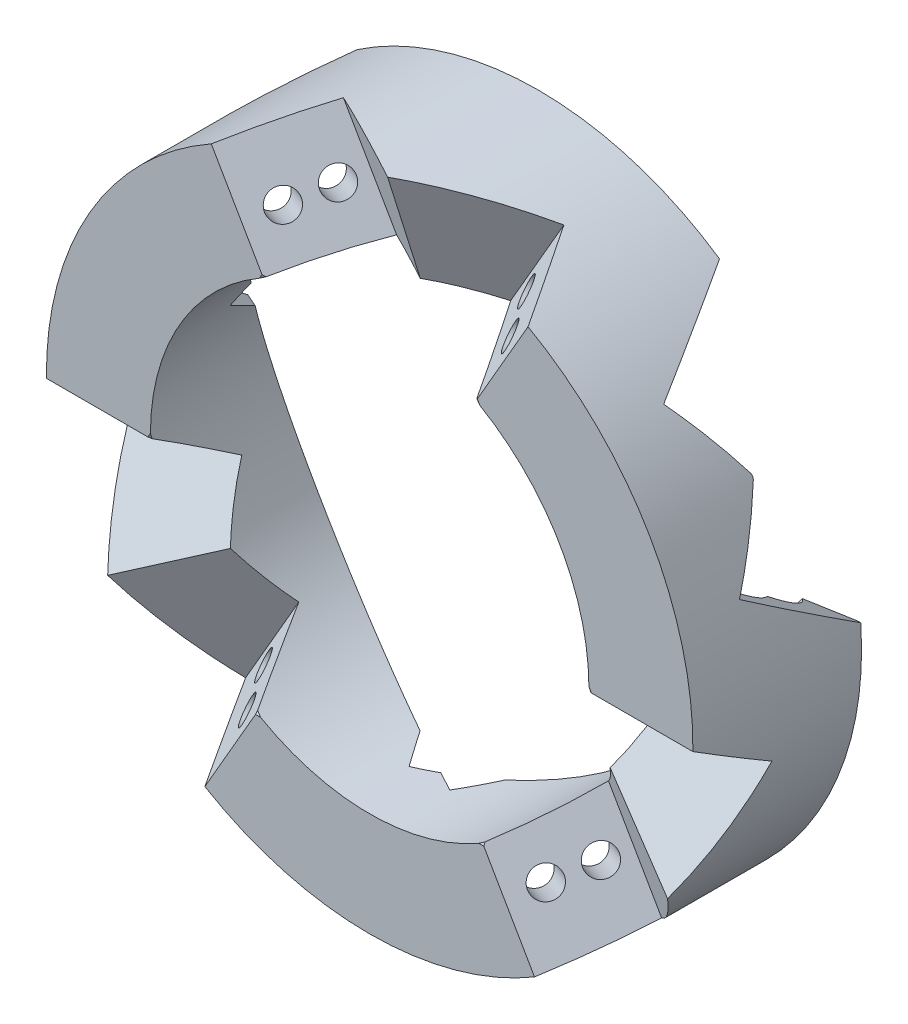
from build123d import *

# Parameters (mm, degrees)
ESQUISSE1_R                            = 57.5
ESQUISSE1_R_2                          = 39
BOSS_EXTRU_1_DEPTH                     = 30
EMPREINTE1_START                       = -29.216029699
EMPREINTE1_OUTLINE_W                   = 12.7
EMPREINTE1_OUTLINE_H                   = 43.583730479
EMPREINTE1_OUTLINE_R                   = 2
EMPREINTE1_DEPTH                       = 12.7
EMPREINTE1_2_OUTLINE_R                 = 2
EMPREINTE1_2_DEPTH                     = 12.7
EMPREINTE1_START_2                     = 16.516029699
EMPREINTE1_3_OUTLINE_R                 = 2
EMPREINTE1_3_DEPTH                     = 12.7
ENL_V_MAT_EXTRU_1_DEPTH                = 98.239996451
ENL_V_MAT_EXTRU_4_DEPTH                = 98.239996451
ENL_V_START                            = -56.415565666
ENL_V_MAT_EXTRU_7_DEPTH                = 36.415565666
R_P_TITION_CIRCULAIRE3_COUNT           = 3
R_P_TITION_CIRCULAIRE1_COUNT           = 3
R_P_TITION_START                       = -56.415565666
R_P_TITION_CIRCULAIRE1_COPY_1_DEPTH    = 36.415565666
R_P_TITION_CIRCULAIRE1_COPY_2_DEPTH    = 36.415565666
ESQUISSE9_R                            = 2.5
ENL_V_MAT_EXTRU_8_DEPTH                = 95.163964789
ENL_V_START_2                          = -10
ENL_V_MAT_EXTRU_9_DEPTH                = 85.163964789
R_P_TITION_CIRCULAIRE2_COUNT           = 3
R_P_TITION_CIRCULAIRE2_COPY_1_SKETCH_R = 2.5
R_P_TITION_CIRCULAIRE2_COPY_1_DEPTH    = 95.163964789
R_P_TITION_CIRCULAIRE2_COPY_2_SKETCH_R = 2.5
R_P_TITION_CIRCULAIRE2_COPY_2_DEPTH    = 95.163964789
R_P_TITION_START_2                     = -10
R_P_TITION_CIRCULAIRE2_COPY_3_DEPTH    = 85.163964789
R_P_TITION_CIRCULAIRE2_COPY_4_DEPTH    = 85.163964789


# Read off the part's stored shape, not the designer's step: Empreinte1, Enlèv. mat.-Extru.7
with BuildPart() as part:
    # Esquisse1 → Boss.-Extru.1 (new body)
    with BuildSketch(Plane.XY):
        Circle(ESQUISSE1_R)
        Circle(ESQUISSE1_R_2, mode=Mode.SUBTRACT)
    extrude(amount=BOSS_EXTRU_1_DEPTH)

    # Empreinte1 outline → Empreinte1 (cut)
    # profile 1 of 2: a face of its own
    with BuildSketch(Plane(origin=(0, 0, 0), x_dir=(1, 0, 0), z_dir=(0, 0.8468899888530684, -0.5317681325356474)).offset(EMPREINTE1_START)):
        with Locations((46.765371804, -29.208134761)):
            Rectangle(EMPREINTE1_OUTLINE_W, EMPREINTE1_OUTLINE_H)
        with Locations((46.765371804, -19.416269521)):
            Circle(EMPREINTE1_OUTLINE_R, mode=Mode.SUBTRACT)
        with Locations((46.765371804, -11.916269521)):
            Circle(EMPREINTE1_OUTLINE_R, mode=Mode.SUBTRACT)
    # profile 2 of 2: a face of its own
    with BuildSketch(Plane(origin=(0, 0, 0), x_dir=(1, 0, 0), z_dir=(0, 0.8468899888530684, -0.5317681325356474)).offset(EMPREINTE1_START)):
        with Locations((-46.765371804, -29.208134761)):
            Rectangle(EMPREINTE1_OUTLINE_W, EMPREINTE1_OUTLINE_H)
        with Locations((-46.765371804, -19.416269521)):
            Circle(EMPREINTE1_OUTLINE_R, mode=Mode.SUBTRACT)
        with Locations((-46.765371804, -11.916269521)):
            Circle(EMPREINTE1_OUTLINE_R, mode=Mode.SUBTRACT)
    extrude(amount=EMPREINTE1_DEPTH, mode=Mode.SUBTRACT)

    # Empreinte1 2 outline → Empreinte1 2 (cut)
    # profile 1 of 2: a face of its own
    with BuildSketch(Plane(origin=(0, 0, 0), x_dir=(0.6797668792206172, 0.45687209604119283, 0.5737463531680093), z_dir=(0.7334282445574773, -0.42344499442653416, -0.5317681325356473)).offset(EMPREINTE1_START)):
        Polygon((58, 3.315715307), (34.751709751, -21.925373453), (44.093147521, -30.529299325), (56.041715761, -17.556522906), (58, -15.430378326), align=None)
        with Locations((42.471063787, -22.917378124)):
            Circle(EMPREINTE1_2_OUTLINE_R, mode=Mode.SUBTRACT)
        with Locations((47.552122372, -17.400781016)):
            Circle(EMPREINTE1_2_OUTLINE_R, mode=Mode.SUBTRACT)
    # profile 2 of 2: a face of its own
    with BuildSketch(Plane(origin=(0, 0, 0), x_dir=(0.6797668792206172, 0.45687209604119283, 0.5737463531680093), z_dir=(0.7334282445574773, -0.42344499442653416, -0.5317681325356473)).offset(EMPREINTE1_START)):
        Polygon((-12.754474866, 45.808168802), (-3.367294617, 56), (-20.63337335, 56), (-22.095912635, 54.412094674), (-34.044480875, 41.439318255), (-24.703043106, 32.835392384), align=None)
        with Locations((-26.325126839, 40.447313584)):
            Circle(EMPREINTE1_2_OUTLINE_R, mode=Mode.SUBTRACT)
        with Locations((-21.244068254, 45.963910692)):
            Circle(EMPREINTE1_2_OUTLINE_R, mode=Mode.SUBTRACT)
    extrude(amount=EMPREINTE1_2_DEPTH, mode=Mode.SUBTRACT)

    # Empreinte1 3 outline → Empreinte1 3 (cut)
    # profile 1 of 2: a face of its own
    with BuildSketch(Plane(origin=(0, 0, 0), x_dir=(0.6797668792206174, -0.45687209604119206, -0.5737463531680094), z_dir=(0.733428244557477, 0.423444994426534, 0.531768132535648)).offset(EMPREINTE1_START_2)):
        Polygon((-34.751709751, 21.925373453), (-44.093147521, 30.529299325), (-56.041715761, 17.556522906), (-58, 15.430378326), (-58, -3.315715307), align=None)
        with Locations((-47.552122372, 17.400781016)):
            Circle(EMPREINTE1_3_OUTLINE_R, mode=Mode.SUBTRACT)
        with Locations((-42.471063787, 22.917378124)):
            Circle(EMPREINTE1_3_OUTLINE_R, mode=Mode.SUBTRACT)
    # profile 2 of 2: a face of its own
    with BuildSketch(Plane(origin=(0, 0, 0), x_dir=(0.6797668792206174, -0.45687209604119206, -0.5737463531680094), z_dir=(0.733428244557477, 0.423444994426534, 0.531768132535648)).offset(EMPREINTE1_START_2)):
        Polygon((12.754474866, -45.808168802), (3.367294617, -56), (20.63337335, -56), (22.095912635, -54.412094674), (34.044480875, -41.439318255), (24.703043106, -32.835392384), align=None)
        with Locations((21.244068254, -45.963910692)):
            Circle(EMPREINTE1_3_OUTLINE_R, mode=Mode.SUBTRACT)
        with Locations((26.325126839, -40.447313584)):
            Circle(EMPREINTE1_3_OUTLINE_R, mode=Mode.SUBTRACT)
    extrude(amount=EMPREINTE1_3_DEPTH, mode=Mode.SUBTRACT)

    # Esquisse2 → Enlèv. mat.-Extru.1 (cut, through all)
    with BuildSketch(Plane(origin=(12.113322669, 6.993630104, 8.78269827), x_dir=(0.18833993709887123, 0.6250712029311548, -0.7575051546753939), z_dir=(0.733428244557477, 0.4234449944265346, 0.5317681325356474))):
        Polygon((-22.408962345, 11.202726751), (-48.120522756, -40.22844727), (-32.345081251, -48.114932947), (-6.63352084, 3.316241075), align=None)
    enl_v_mat_extru_1 = extrude(amount=ENL_V_MAT_EXTRU_1_DEPTH, mode=Mode.SUBTRACT)

    # Esquisse5 → Enlèv. mat.-Extru.4 (cut, through all)
    with BuildSketch(Plane(origin=(12.113322669, 6.993630104, 8.78269827), x_dir=(0.4582483889207137, 0.2698157971577035, -0.8468812488511737), z_dir=(0.733428244557477, 0.42344499442653444, 0.5317681325356477))):
        Polygon((-24.791707888, 57.61322678), (-25.05293845, 0.113820187), (-7.416192984, 0.033693152), (-7.154962421, 57.533099746), align=None)
    enl_v_mat_extru_4 = extrude(amount=ENL_V_MAT_EXTRU_4_DEPTH, mode=Mode.SUBTRACT)

    # Enlèv. mat.-Extru.7 outline → Enlèv. mat.-Extru.7 (cut)
    with BuildSketch(Plane(origin=(12.113322669, 6.993630104, 8.78269827), x_dir=(0.18833993709887123, 0.6250712029311548, -0.7575051546753939), z_dir=(0.733428244557477, 0.4234449944265346, 0.5317681325356474)).offset(ENL_V_START)):
        Polygon((-22.408962345, 11.202726751), (-48.120522756, -40.22844727), (1.318540819, -64.944108422), (14.973713074, -7.48568423), align=None)
    enl_v_mat_extru_7 = extrude(amount=ENL_V_MAT_EXTRU_7_DEPTH, mode=Mode.SUBTRACT)

    # Répétition circulaire3: Enlèv. mat.-Extru.1, Enlèv. mat.-Extru.4 ×3 about axis
    r_p_tition_circulaire3_axis = Axis((0, 0, 0), (0, 0, 1))
    add([enl_v_mat_extru_1.rotate(r_p_tition_circulaire3_axis, i * 360 / R_P_TITION_CIRCULAIRE3_COUNT) for i in range(1, R_P_TITION_CIRCULAIRE3_COUNT)], mode=Mode.SUBTRACT)
    add([enl_v_mat_extru_4.rotate(r_p_tition_circulaire3_axis, i * 360 / R_P_TITION_CIRCULAIRE3_COUNT) for i in range(1, R_P_TITION_CIRCULAIRE3_COUNT)], mode=Mode.SUBTRACT)

    # Symétrie2: Enlèv. mat.-Extru.7 across plane
    add(enl_v_mat_extru_7.mirror(Plane(origin=(0, 0, 0), x_dir=(0, 0, 1), z_dir=(1, 0, 0))), mode=Mode.SUBTRACT)

    # Répétition circulaire1: Enlèv. mat.-Extru.7 ×3 about axis
    r_p_tition_circulaire1_axis = Axis((0, 0, 0), (0, 0, 1))
    for i in range(1, R_P_TITION_CIRCULAIRE1_COUNT):
        add(enl_v_mat_extru_7.rotate(r_p_tition_circulaire1_axis, i * 360 / R_P_TITION_CIRCULAIRE1_COUNT), mode=Mode.SUBTRACT)

    # Répétition circulaire1 copy 1 sketch → Répétition circulaire1 copy 1 (cut)
    with BuildSketch(Plane(origin=(0, -13.987260208, 8.78269827), x_dir=(-0.44715757236304254, -0.475642771540363, -0.7575051546753939), z_dir=(0, -0.8468899888530683, 0.5317681325356474)).offset(R_P_TITION_START)):
        Polygon((-22.408962345, -11.202726751), (-48.120522756, 40.22844727), (1.318540819, 64.944108422), (14.973713074, 7.48568423), align=None)
    extrude(amount=R_P_TITION_CIRCULAIRE1_COPY_1_DEPTH, mode=Mode.SUBTRACT)

    # Répétition circulaire1 copy 2 sketch → Répétition circulaire1 copy 2 (cut)
    with BuildSketch(Plane(origin=(12.113322669, 6.993630104, 8.78269827), x_dir=(0.6354975094619136, -0.149428431390792, -0.7575051546753939), z_dir=(0.7334282445574778, 0.42344499442653327, 0.5317681325356474)).offset(R_P_TITION_START)):
        Polygon((-22.408962345, -11.202726751), (-48.120522756, 40.22844727), (1.318540819, 64.944108422), (14.973713074, 7.48568423), align=None)
    extrude(amount=R_P_TITION_CIRCULAIRE1_COPY_2_DEPTH, mode=Mode.SUBTRACT)

    # Esquisse9 → Enlèv. mat.-Extru.8 (cut, through all)
    with BuildSketch(Plane(origin=(0, -13.987260208, 8.78269827), x_dir=(1, 0, 0), z_dir=(0, -0.8468899888530684, 0.5317681325356473))):
        with Locations(Location((46.765371804, 19.416269521, 0), (0, 0, 270))):
            Circle(ESQUISSE9_R)
        with Locations(Location((46.765371804, 11.916269521, 0), (0, 0, 270))):
            Circle(ESQUISSE9_R)
    enl_v_mat_extru_8 = extrude(amount=-ENL_V_MAT_EXTRU_8_DEPTH, mode=Mode.SUBTRACT)

    # Esquisse10 → Enlèv. mat.-Extru.9 (cut, through all)
    with BuildSketch(Plane(origin=(0, -13.987260208, 8.78269827), x_dir=(1, 0, 0), z_dir=(0, -0.8468899888530684, 0.5317681325356473)).offset(ENL_V_START_2)):
        with BuildLine():
            ThreePointArc((52.07456195, 15.666269521), (46.765371804, 25.916269521), (41.456181659, 15.666269521))
            ThreePointArc((41.456181659, 15.666269521), (46.765371804, 5.416269521), (52.07456195, 15.666269521))
        make_face()
    enl_v_mat_extru_9 = extrude(amount=-ENL_V_MAT_EXTRU_9_DEPTH, mode=Mode.SUBTRACT)

    # Symétrie1: Enlèv. mat.-Extru.8, Enlèv. mat.-Extru.9 across plane
    add(enl_v_mat_extru_8.mirror(Plane(origin=(0, 0, 0), x_dir=(0, 0, 1), z_dir=(1, 0, 0))), mode=Mode.SUBTRACT)
    add(enl_v_mat_extru_9.mirror(Plane(origin=(0, 0, 0), x_dir=(0, 0, 1), z_dir=(1, 0, 0))), mode=Mode.SUBTRACT)

    # Répétition circulaire2: Enlèv. mat.-Extru.8, Enlèv. mat.-Extru.9 ×3 about axis
    r_p_tition_circulaire2_axis = Axis((0, 0, 0), (0, 0, 1))
    add([enl_v_mat_extru_8.rotate(r_p_tition_circulaire2_axis, i * 360 / R_P_TITION_CIRCULAIRE2_COUNT) for i in range(1, R_P_TITION_CIRCULAIRE2_COUNT)], mode=Mode.SUBTRACT)
    add([enl_v_mat_extru_9.rotate(r_p_tition_circulaire2_axis, i * 360 / R_P_TITION_CIRCULAIRE2_COUNT) for i in range(1, R_P_TITION_CIRCULAIRE2_COUNT)], mode=Mode.SUBTRACT)

    # Répétition circulaire2 copy 1 sketch → Répétition circulaire2 copy 1 (cut, through all)
    with BuildSketch(Plane(origin=(12.113322669, 6.993630104, 8.78269827), x_dir=(0.4999999999999998, -0.8660254037844387, 0), z_dir=(0.7334282445574773, 0.42344499442653405, 0.5317681325356473))):
        with Locations((46.765371804, -19.416269521)):
            Circle(R_P_TITION_CIRCULAIRE2_COPY_1_SKETCH_R)
        with Locations((46.765371804, -11.916269521)):
            Circle(R_P_TITION_CIRCULAIRE2_COPY_1_SKETCH_R)
    extrude(amount=-R_P_TITION_CIRCULAIRE2_COPY_1_DEPTH, mode=Mode.SUBTRACT)

    # Répétition circulaire2 copy 2 sketch → Répétition circulaire2 copy 2 (cut, through all)
    with BuildSketch(Plane(origin=(-12.113322669, 6.993630104, 8.78269827), x_dir=(0.5000000000000004, 0.8660254037844384, 0), z_dir=(-0.7334282445574771, 0.4234449944265346, 0.5317681325356473))):
        with Locations((46.765371804, -19.416269521)):
            Circle(R_P_TITION_CIRCULAIRE2_COPY_2_SKETCH_R)
        with Locations((46.765371804, -11.916269521)):
            Circle(R_P_TITION_CIRCULAIRE2_COPY_2_SKETCH_R)
    extrude(amount=-R_P_TITION_CIRCULAIRE2_COPY_2_DEPTH, mode=Mode.SUBTRACT)

    # Répétition circulaire2 copy 3 sketch → Répétition circulaire2 copy 3 (cut, through all)
    with BuildSketch(Plane(origin=(12.113322669, 6.993630104, 8.78269827), x_dir=(0.4999999999999998, -0.8660254037844387, 0), z_dir=(0.7334282445574773, 0.42344499442653405, 0.5317681325356473)).offset(R_P_TITION_START_2)):
        with BuildLine():
            ThreePointArc((52.07456195, -15.666269521), (46.765371804, -25.916269521), (41.456181659, -15.666269521))
            ThreePointArc((41.456181659, -15.666269521), (46.765371804, -5.416269521), (52.07456195, -15.666269521))
        make_face()
    extrude(amount=-R_P_TITION_CIRCULAIRE2_COPY_3_DEPTH, mode=Mode.SUBTRACT)

    # Répétition circulaire2 copy 4 sketch → Répétition circulaire2 copy 4 (cut, through all)
    with BuildSketch(Plane(origin=(-12.113322669, 6.993630104, 8.78269827), x_dir=(0.5000000000000004, 0.8660254037844384, 0), z_dir=(-0.7334282445574771, 0.4234449944265346, 0.5317681325356473)).offset(R_P_TITION_START_2)):
        with BuildLine():
            ThreePointArc((52.07456195, -15.666269521), (46.765371804, -25.916269521), (41.456181659, -15.666269521))
            ThreePointArc((41.456181659, -15.666269521), (46.765371804, -5.416269521), (52.07456195, -15.666269521))
        make_face()
    extrude(amount=-R_P_TITION_CIRCULAIRE2_COPY_4_DEPTH, mode=Mode.SUBTRACT)


solid = part.part
